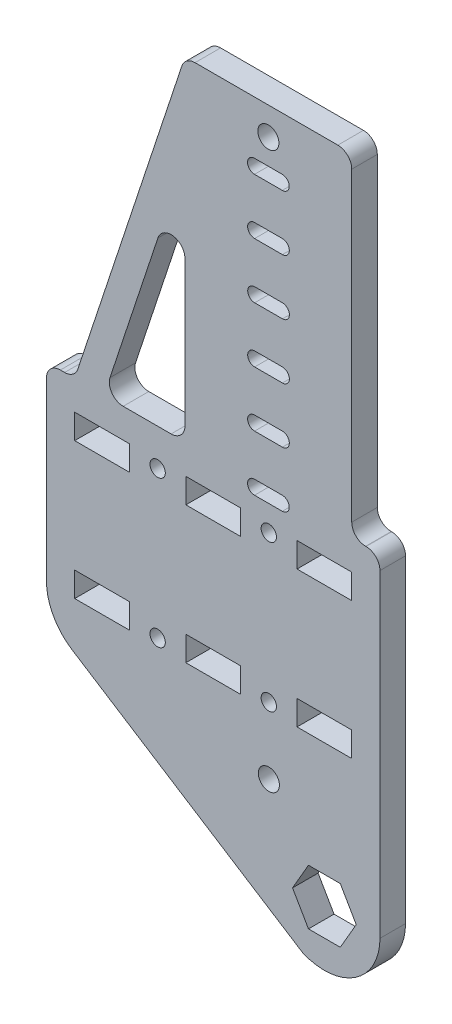
from build123d import *

# Parameters (mm, degrees)
SKETCH1_W           = 12.5
SKETCH1_H           = 5.642
SKETCH1_R           = 1.7526
SKETCH1_R_2         = 2.413
BOSS_EXTRUDE1_DEPTH = 5.842
FILLET1_R           = 3.175
FILLET2_R           = 3.175
FILLET3_R           = 3.175
SKETCH3_R           = 2.413
CUT_EXTRUDE2_DEPTH  = 109.428551037
CUT_EXTRUDE7_DEPTH  = 109.428551037
FILLET9_R           = 12.7


with BuildPart() as part:
    # Sketch1 → Boss-Extrude1 (new body)
    with BuildSketch(Plane.XY):
        with BuildLine():
            Line((38.1, -25.146), (38.1, -12.8))
            Line((38.1, -12.8), (38.1, 12.8))
            Line((38.1, 12.8), (38.1, 25.146))
            Line((38.1, 25.146), (31.65, 25.146))
            Line((31.65, 25.146), (31.65, 101.346))
            Line((31.65, 101.346), (-6.45, 101.346))
            Line((-6.45, 101.346), (-31.65, 25.146))
            Line((-31.65, 25.146), (-38.1, 25.146))
            Line((-38.1, 25.146), (-38.1, 12.8))
            Line((-38.1, 12.8), (-38.1, -12.8))
            Line((-38.1, -12.8), (-38.1, -25.146))
            Line((-38.1, -25.146), (20.47218349, -62.50498289))
            ThreePointArc((20.47218349, -62.50498289), (32.425195027, -61.380011098), (38.1, -50.8))
            Line((38.1, -50.8), (38.1, -25.146))
        make_face()
        with Locations((-25.4, -15.621)):
            Rectangle(SKETCH1_W, SKETCH1_H, mode=Mode.SUBTRACT)
        with Locations((-25.4, 15.621)):
            Rectangle(SKETCH1_W, SKETCH1_H, mode=Mode.SUBTRACT)
        with Locations((-12.7, -16.76875)):
            Circle(SKETCH1_R, mode=Mode.SUBTRACT)
        with Locations((0, -15.621)):
            Rectangle(SKETCH1_W, SKETCH1_H, mode=Mode.SUBTRACT)
        with Locations((-12.7, 16.76875)):
            Circle(SKETCH1_R, mode=Mode.SUBTRACT)
        Polygon((29.037306696, -44.5), (32.674613392, -50.8), (29.037306696, -57.1), (21.762693304, -57.1), (18.125386608, -50.8), (21.762693304, -44.5), align=None, mode=Mode.SUBTRACT)
        with Locations((12.7, -16.76875)):
            Circle(SKETCH1_R, mode=Mode.SUBTRACT)
        with Locations((0, 15.621)):
            Rectangle(SKETCH1_W, SKETCH1_H, mode=Mode.SUBTRACT)
        with Locations((12.7, 16.76875)):
            Circle(SKETCH1_R, mode=Mode.SUBTRACT)
        with Locations((25.4, -15.621)):
            Rectangle(SKETCH1_W, SKETCH1_H, mode=Mode.SUBTRACT)
        with Locations((25.4, 15.621)):
            Rectangle(SKETCH1_W, SKETCH1_H, mode=Mode.SUBTRACT)
        Polygon((-24.961764059, 25.146), (-6.45, 81.122048465), (-6.45, 25.146), align=None, mode=Mode.SUBTRACT)
        with Locations((12.6, 94.996)):
            Circle(SKETCH1_R_2, mode=Mode.SUBTRACT)
    extrude(amount=BOSS_EXTRUDE1_DEPTH)

    # Fillet1
    fillet1_edges = [part.edges().sort_by_distance(p)[0] for p in [
        (-38.1, 25.146, 2.921),
        (38.1, 25.146, 2.921),
        (-31.65, 25.146, 2.921),
        (31.65, 25.146, 2.921),
    ]]
    fillet(fillet1_edges, radius=FILLET1_R)

    # Fillet2
    fillet2_edges = [part.edges().sort_by_distance(p)[0] for p in [
        (-6.45, 25.146, 2.921),
        (-6.45, 81.122048465, 2.921),
        (-24.961764059, 25.146, 2.921),
    ]]
    fillet(fillet2_edges, radius=FILLET2_R)

    # Fillet3
    fillet3_edges = [part.edges().sort_by_distance(p)[0] for p in [
        (31.65, 101.346, 2.921),
        (-6.45, 101.346, 2.921),
    ]]
    fillet(fillet3_edges, radius=FILLET3_R)

    # Sketch3 → Cut-Extrude2 (cut, through all)
    with BuildSketch(Plane.XY.offset(5.842)):
        with Locations((12.713631534, -32.004)):
            Circle(SKETCH3_R)
    extrude(amount=-CUT_EXTRUDE2_DEPTH, mode=Mode.SUBTRACT)

    # Sketch11 → Cut-Extrude7 (cut, through all)
    with BuildSketch(Plane.XY.offset(5.842)):
        with BuildLine():
            Line((9.466882624, 63.819875), (15.816882624, 63.819875))
            ThreePointArc((15.816882624, 63.819875), (17.404382624, 62.232375), (15.816882624, 60.644875))
            Line((15.816882624, 60.644875), (9.466882624, 60.644875))
            ThreePointArc((9.466882624, 60.644875), (7.879382624, 62.232375), (9.466882624, 63.819875))
        make_face()
        with BuildLine():
            Line((9.450647885, 76.519864623), (15.800647885, 76.519864623))
            ThreePointArc((15.800647885, 76.519864623), (17.388147885, 74.932364623), (15.800647885, 73.344864623))
            Line((15.800647885, 73.344864623), (9.450647885, 73.344864623))
            ThreePointArc((9.450647885, 73.344864623), (7.863147885, 74.932364623), (9.450647885, 76.519864623))
        make_face()
        with BuildLine():
            Line((9.434413147, 89.219854247), (15.784413147, 89.219854247))
            ThreePointArc((15.784413147, 89.219854247), (17.371913147, 87.632354247), (15.784413147, 86.044854247))
            Line((15.784413147, 86.044854247), (9.434413147, 86.044854247))
            ThreePointArc((9.434413147, 86.044854247), (7.846913147, 87.632354247), (9.434413147, 89.219854247))
        make_face()
        with BuildLine():
            Line((9.434413147, 22.544895753), (15.784413147, 22.544895753))
            ThreePointArc((15.784413147, 22.544895753), (17.371913147, 24.132395753), (15.784413147, 25.719895753))
            Line((15.784413147, 25.719895753), (9.434413147, 25.719895753))
            ThreePointArc((9.434413147, 25.719895753), (7.846913147, 24.132395753), (9.434413147, 22.544895753))
        make_face()
        with BuildLine():
            Line((9.450647885, 35.244885377), (15.800647885, 35.244885377))
            ThreePointArc((15.800647885, 35.244885377), (17.388147885, 36.832385377), (15.800647885, 38.419885377))
            Line((15.800647885, 38.419885377), (9.450647885, 38.419885377))
            ThreePointArc((9.450647885, 38.419885377), (7.863147885, 36.832385377), (9.450647885, 35.244885377))
        make_face()
        with BuildLine():
            Line((9.466882624, 47.944875), (15.816882624, 47.944875))
            ThreePointArc((15.816882624, 47.944875), (17.404382624, 49.532375), (15.816882624, 51.119875))
            Line((15.816882624, 51.119875), (9.466882624, 51.119875))
            ThreePointArc((9.466882624, 51.119875), (7.879382624, 49.532375), (9.466882624, 47.944875))
        make_face()
    extrude(amount=-CUT_EXTRUDE7_DEPTH, mode=Mode.SUBTRACT)

    # Fillet9
    fillet9_edges = [part.edges().sort_by_distance(p)[0] for p in [
        (-38.1, -25.146, 2.921),
    ]]
    fillet(fillet9_edges, radius=FILLET9_R)


solid = part.part
